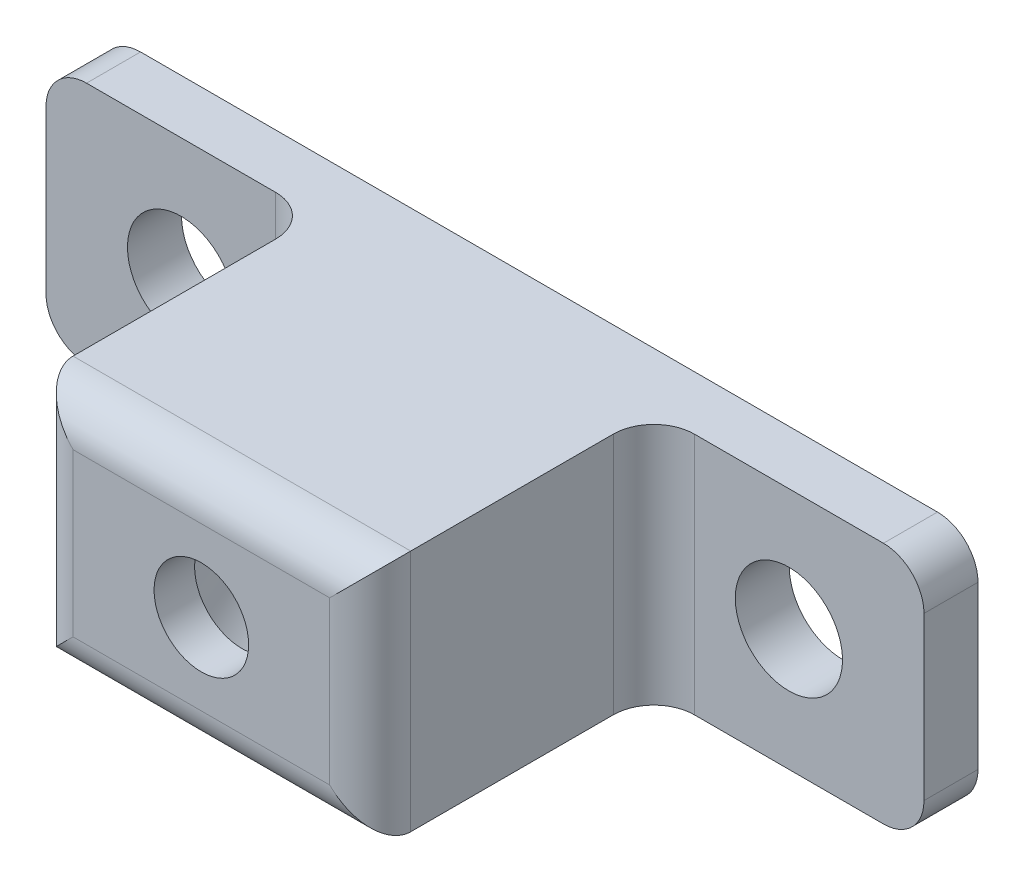
from build123d import *

# Parameters (mm, degrees)
SKETCH1_W           = 25
SKETCH1_H           = 18
SKETCH1_R           = 3.5
BOSS_EXTRUDE1_DEPTH = 25
SKETCH2_W           = 20
SKETCH2_H           = 18
SKETCH2_R           = 3.96875
BOSS_EXTRUDE2_DEPTH = 4
FILLET2_R           = 3
FILLET4_R           = 3
SKETCH3_R           = 4.65
CUT_EXTRUDE1_DEPTH  = 22
SKETCH5_W           = 19
SKETCH5_H           = 12
CUT_EXTRUDE2_DEPTH  = 22
CHAMFER1_SIZE       = 1.25
CHAMFER1_SIZE2      = 4.665063509
CHAMFER2_SIZE       = 4.5
CHAMFER2_SIZE2      = 7.794228634
FILLET5_R           = 5.54
SKETCH7_W           = 3
SKETCH7_H           = 3
CUT_EXTRUDE3_DEPTH  = 6


with BuildPart() as part:
    # Sketch1 → Boss-Extrude1 (new body)
    with BuildSketch(Plane.XY):
        with Locations((12.5, 9)):
            Rectangle(SKETCH1_W, SKETCH1_H)
        with Locations((12.5, 9)):
            Circle(SKETCH1_R, mode=Mode.SUBTRACT)
    extrude(amount=BOSS_EXTRUDE1_DEPTH)

    # Sketch2 → Boss-Extrude2 (add)
    # profile 1 of 2: a face of its own
    with BuildSketch(Plane(origin=(0, 0, 0), x_dir=(-1, 0, 0), z_dir=(0, 0, -1))):
        with Locations((10, 9)):
            Rectangle(SKETCH2_W, SKETCH2_H)
        with Locations((10, 9)):
            Circle(SKETCH2_R, mode=Mode.SUBTRACT)
    # profile 2 of 2: a face of its own
    with BuildSketch(Plane(origin=(0, 0, 0), x_dir=(-1, 0, 0), z_dir=(0, 0, -1))):
        with Locations((-35, 9)):
            Rectangle(SKETCH2_W, SKETCH2_H)
        with Locations((-35, 9)):
            Circle(SKETCH2_R, mode=Mode.SUBTRACT)
    extrude(amount=-BOSS_EXTRUDE2_DEPTH)

    # Fillet2
    fillet2_edges = [part.edges().sort_by_distance(p)[0] for p in [
        (0, 9, 4),
        (-20, 0, 2),
        (-20, 18, 2),
        (45, 0, 2),
        (45, 18, 2),
        (25, 9, 4),
    ]]
    fillet(fillet2_edges, radius=FILLET2_R)

    # Fillet4
    fillet4_edges = [part.edges().sort_by_distance(p)[0] for p in [
        (12.5, 0, 25),
        (12.5, 18, 25),
        (0, 9, 25),
        (25, 9, 25),
    ]]
    fillet(fillet4_edges, radius=FILLET4_R)

    # Sketch3 → Cut-Extrude1 (cut)
    with BuildSketch(Plane(origin=(0, 0, 0), x_dir=(-1, 0, 0), z_dir=(0, 0, -1))):
        with Locations((-12.5, 9)):
            Circle(SKETCH3_R)
    extrude(amount=-CUT_EXTRUDE1_DEPTH, mode=Mode.SUBTRACT)

    # Sketch5 → Cut-Extrude2 (cut)
    with BuildSketch(Plane(origin=(0, 0, 0), x_dir=(-1, 0, 0), z_dir=(0, 0, -1))):
        with Locations((-12.5, 9)):
            Rectangle(SKETCH5_W, SKETCH5_H)
    extrude(amount=-CUT_EXTRUDE2_DEPTH, mode=Mode.SUBTRACT)

    # Chamfer1
    chamfer1_edges = [part.edges().sort_by_distance(p)[0] for p in [
        (12.5, 3, 22),
        (12.5, 15, 22),
    ]]
    chamfer1_side = [part.faces().sort_by_distance(p)[0] for p in [
        (12.5, 3.224722051, 22),
    ]]
    chamfer(chamfer1_edges, length=CHAMFER1_SIZE, length2=CHAMFER1_SIZE2, reference=chamfer1_side[0])

    # Chamfer2
    chamfer2_edges = [part.edges().sort_by_distance(p)[0] for p in [
        (22, 9, 22),
        (3, 9, 22),
    ]]
    chamfer2_side = [part.faces().sort_by_distance(p)[0] for p in [
        (21.787573542, 9, 22),
    ]]
    chamfer(chamfer2_edges, length=CHAMFER2_SIZE, length2=CHAMFER2_SIZE2, reference=chamfer2_side[0])

    # Fillet5
    # the kernel refuses this fillet: 5.54 mm, written as the material it adds along each edge
    with BuildSketch(Plane(origin=(13.422596023, 6.99868638, 32.258237225), x_dir=(-0.11302231218972587, 0.9741169476962979, -0.19576038710151827), z_dir=(-0.48705847384814693, -0.22604462437945333, -0.8436100229619524))) as fillet5_piece_1_section:
        with BuildLine():
            CenterArc((FILLET5_R * 0.877973148149, FILLET5_R), FILLET5_R, 187.435472226, 82.564527774)
            Line((-FILLET5_R * 0.113618085915, FILLET5_R * 0.870590477449), (0, 0))
            Line((0, 0), (FILLET5_R * 0.877973148149, 0))
        make_face()
    fillet5_piece_1 = extrude(amount=29.849737763, mode=Mode.PRIVATE)
    fillet5_piece_1 = split(fillet5_piece_1, bisect_by=Plane(origin=(6.414237593, 4.456810382, 22), z_dir=(0, 0, -1)), keep=Keep.TOP, mode=Mode.PRIVATE)
    fillet5_piece_1 = split(fillet5_piece_1, bisect_by=Plane(origin=(6.414237593, 0, 18.189685112), z_dir=(0, 1, 0)), keep=Keep.TOP, mode=Mode.PRIVATE)
    fillet5_piece_1 = split(fillet5_piece_1, bisect_by=Plane(origin=(0, 4.456810382, 18.189685112), z_dir=(1, 0, 0)), keep=Keep.TOP, mode=Mode.PRIVATE)
    add(fillet5_piece_1)
    with BuildSketch(Plane(origin=(11.577403977, 6.99868638, 32.258237225), x_dir=(-0.8733693623277119, -0.12606000911046675, -0.4704623588028643), z_dir=(0.48705847384814693, -0.2260446243794534, -0.8436100229619524))) as fillet5_piece_2_section:
        with BuildLine():
            CenterArc((FILLET5_R * 0.877973148149, FILLET5_R), FILLET5_R, 187.435472226, 82.564527774)
            Line((-FILLET5_R * 0.113618085915, FILLET5_R * 0.870590477449), (0, 0))
            Line((0, 0), (FILLET5_R * 0.877973148149, 0))
        make_face()
    fillet5_piece_2 = extrude(amount=29.849737763, mode=Mode.PRIVATE)
    fillet5_piece_2 = split(fillet5_piece_2, bisect_by=Plane(origin=(18.585762403, 4.456810384, 22), z_dir=(0, 0, -1)), keep=Keep.TOP, mode=Mode.PRIVATE)
    fillet5_piece_2 = split(fillet5_piece_2, bisect_by=Plane(origin=(18.585762403, 0, 18.189685124), z_dir=(0, 1, 0)), keep=Keep.TOP, mode=Mode.PRIVATE)
    fillet5_piece_2 = split(fillet5_piece_2, bisect_by=Plane(origin=(25, 4.456810384, 18.189685124), z_dir=(-1, 0, 0)), keep=Keep.TOP, mode=Mode.PRIVATE)
    add(fillet5_piece_2)
    with BuildSketch(Plane(origin=(11.577403977, 11.00131362, 32.258237225), x_dir=(0.11302231218972622, -0.9741169476962979, -0.19576038710151802), z_dir=(0.48705847384814693, 0.22604462437945327, -0.8436100229619524))) as fillet5_piece_3_section:
        with BuildLine():
            CenterArc((FILLET5_R * 0.877973148149, FILLET5_R), FILLET5_R, 187.435472226, 82.564527774)
            Line((-FILLET5_R * 0.113618085915, FILLET5_R * 0.870590477449), (0, 0))
            Line((0, 0), (FILLET5_R * 0.877973148149, 0))
        make_face()
    fillet5_piece_3 = extrude(amount=29.849737763, mode=Mode.PRIVATE)
    fillet5_piece_3 = split(fillet5_piece_3, bisect_by=Plane(origin=(18.585762407, 13.543189618, 22), z_dir=(0, 0, -1)), keep=Keep.TOP, mode=Mode.PRIVATE)
    fillet5_piece_3 = split(fillet5_piece_3, bisect_by=Plane(origin=(18.585762407, 18, 18.189685112), z_dir=(0, -1, 0)), keep=Keep.TOP, mode=Mode.PRIVATE)
    fillet5_piece_3 = split(fillet5_piece_3, bisect_by=Plane(origin=(25, 13.543189618, 18.189685112), z_dir=(-1, 0, 0)), keep=Keep.TOP, mode=Mode.PRIVATE)
    add(fillet5_piece_3)
    with BuildSketch(Plane(origin=(13.422596023, 11.00131362, 32.258237225), x_dir=(-0.11302231218972594, -0.9741169476962979, -0.1957603871015184), z_dir=(-0.4870584738481469, 0.22604462437945344, -0.8436100229619524))) as fillet5_piece_4_section:
        with BuildLine():
            CenterArc((FILLET5_R * 0.877973148149, -FILLET5_R), FILLET5_R, 90, 82.564527774)
            Line((-FILLET5_R * 0.113618085915, -FILLET5_R * 0.870590477449), (0, 0))
            Line((0, 0), (FILLET5_R * 0.877973148149, 0))
        make_face()
    fillet5_piece_4 = extrude(amount=29.849737763, mode=Mode.PRIVATE)
    fillet5_piece_4 = split(fillet5_piece_4, bisect_by=Plane(origin=(6.414237593, 13.543189618, 22), z_dir=(0, 0, -1)), keep=Keep.TOP, mode=Mode.PRIVATE)
    fillet5_piece_4 = split(fillet5_piece_4, bisect_by=Plane(origin=(6.414237593, 18, 18.189685112), z_dir=(0, -1, 0)), keep=Keep.TOP, mode=Mode.PRIVATE)
    fillet5_piece_4 = split(fillet5_piece_4, bisect_by=Plane(origin=(0, 13.543189618, 18.189685112), z_dir=(1, 0, 0)), keep=Keep.TOP, mode=Mode.PRIVATE)
    add(fillet5_piece_4)

    # Sketch7 → Cut-Extrude3 (cut)
    with BuildSketch(Plane(origin=(0, 0, 0), x_dir=(-1, 0, 0), z_dir=(0, 0, -1))):
        with Locations((-12.5, 1.5)):
            Rectangle(SKETCH7_W, SKETCH7_H)
    extrude(amount=-CUT_EXTRUDE3_DEPTH, mode=Mode.SUBTRACT)


solid = part.part
